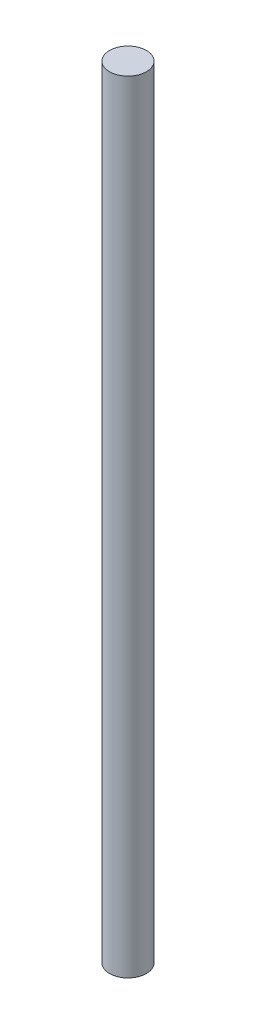
from build123d import *

# Parameters (mm, degrees)
SKETCH1_R           = 6
BOSS_EXTRUDE1_DEPTH = 254


with BuildPart() as part:
    # Sketch1 → Boss-Extrude1 (new body)
    with BuildSketch(Plane(origin=(0, 0, 0), x_dir=(1, 0, 0), z_dir=(0, 1, 0))):
        Circle(SKETCH1_R)
    extrude(amount=BOSS_EXTRUDE1_DEPTH)


solid = part.part
